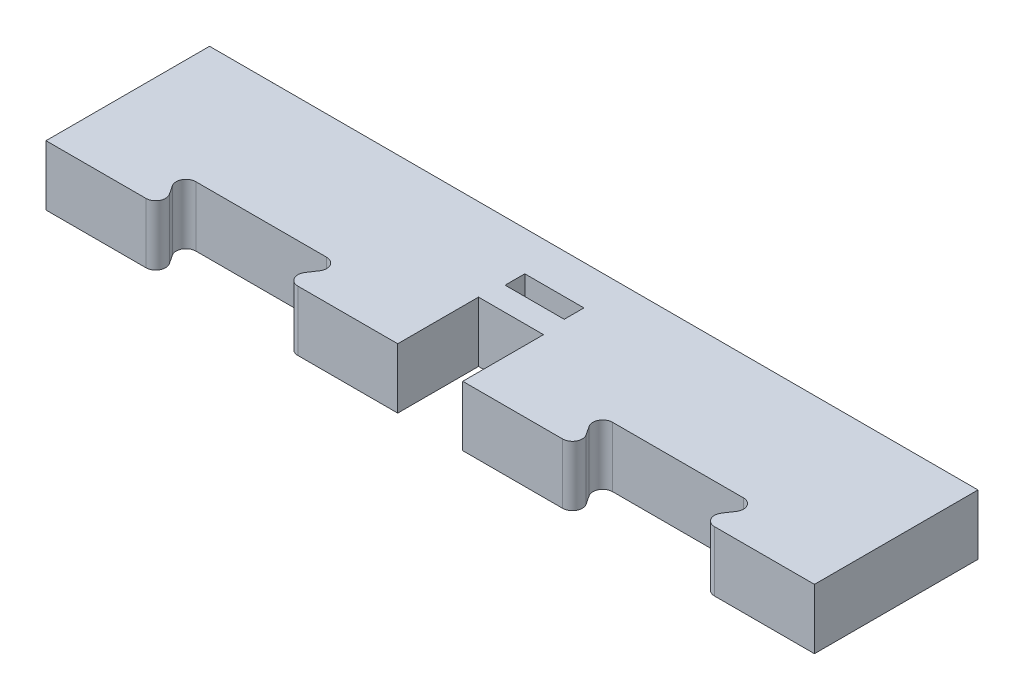
from build123d import *

# Parameters (mm, degrees)
SKETCH1_W           = 39
SKETCH1_H           = 8.3
BOSS_EXTRUDE1_DEPTH = 3.05
CUT_EXTRUDE1_DEPTH  = 40.989904976
SKETCH3_W           = 3
SKETCH3_H           = 1
SKETCH3_W_2         = 3.3
SKETCH3_H_2         = 4.1
CUT_EXTRUDE2_DEPTH  = 40.989904976
FILLET1_R           = 0.5


with BuildPart() as part:
    # Sketch1 → Boss-Extrude1 (new body)
    with BuildSketch(Plane(origin=(0, 0, 0), x_dir=(1, 0, 0), z_dir=(0, 1, 0))):
        with Locations((19.5, 4.15)):
            Rectangle(SKETCH1_W, SKETCH1_H)
    extrude(amount=BOSS_EXTRUDE1_DEPTH)

    # Sketch2 → Cut-Extrude1 (cut, through all)
    with BuildSketch(Plane(origin=(0, 3.05, 0), x_dir=(1, 0, 0), z_dir=(0, 1, 0))):
        Polygon((25.825, 2), (27.15, 0), (33, 0), (34.325, 2), align=None)
        Polygon((4.675, 2), (6, 0), (11.85, 0), (13.175, 2), align=None)
    extrude(amount=-CUT_EXTRUDE1_DEPTH, mode=Mode.SUBTRACT)

    # Sketch3 → Cut-Extrude2 (cut, through all)
    with BuildSketch(Plane(origin=(0, 3.05, 0), x_dir=(1, 0, 0), z_dir=(0, 1, 0))):
        with Locations((19.5, 5.8)):
            Rectangle(SKETCH3_W, SKETCH3_H)
        with Locations((19.5, 2.05)):
            Rectangle(SKETCH3_W_2, SKETCH3_H_2)
    extrude(amount=-CUT_EXTRUDE2_DEPTH, mode=Mode.SUBTRACT)

    # Fillet1
    fillet1_edges = [part.edges().sort_by_distance(p)[0] for p in [
        (33, 1.525, 0),
        (27.15, 1.525, 0),
        (11.85, 1.525, 0),
        (6, 1.525, 0),
        (25.825, 1.525, -2),
        (34.325, 1.525, -2),
        (13.175, 1.525, -2),
        (4.675, 1.525, -2),
    ]]
    fillet(fillet1_edges, radius=FILLET1_R)


solid = part.part
